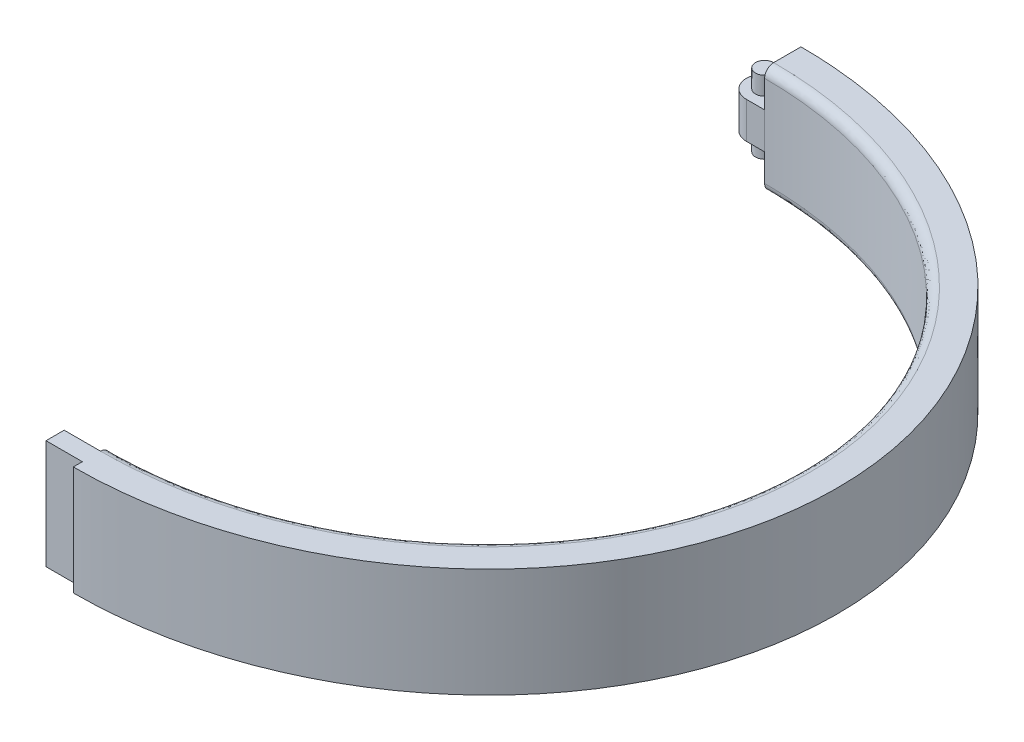
from build123d import *

# Parameters (mm, degrees)
BOSS_EXTRUDE1_DEPTH      = 30
SKETCH2_W                = 10
SKETCH2_H                = 10
BOSS_EXTRUDE2_DEPTH      = 10
BOSS_EXTRUDE3_DEPTH      = 5
BOSS_EXTRUDE3_DEPTH_BACK = 15
SKETCH3_R                = 2.5
SKETCH4_W                = 5
SKETCH4_H                = 30
BOSS_EXTRUDE4_DEPTH      = 10
FILLET2_R                = 5
FILLET1_R                = 2.5


with BuildPart() as part:
    # Sketch1 → Boss-Extrude1 (new body)
    with BuildSketch(Plane(origin=(0, 0, 0), x_dir=(1, 0, 0), z_dir=(0, 1, 0))):
        with BuildLine():
            Line((0, 100), (0, 90))
            add(Edge.make_bspline(
                [(0, -90), (100, -90), (100, 0), (100, 90), (0, 90)],
                knots=[1.570796327, 1.570796327, 1.570796327, 3.141592654, 3.141592654, 4.71238898, 4.71238898, 4.71238898], degree=2, weights=[1, 0.707106781, 1, 0.707106781, 1]))
            Line((0, -90), (0, -100))
            add(Edge.make_bspline(
                [(0, -100), (110, -100), (110, 0), (110, 100), (0, 100)],
                knots=[4.71238898, 4.71238898, 4.71238898, 6.283185307, 6.283185307, 7.853981634, 7.853981634, 7.853981634], degree=2, weights=[1, 0.707106781, 1, 0.707106781, 1]))
        make_face()
    extrude(amount=BOSS_EXTRUDE1_DEPTH)

    # Sketch2 → Boss-Extrude2 (add)
    with BuildSketch(Plane.ZY):
        with Locations((-95, 15)):
            Rectangle(SKETCH2_W, SKETCH2_H)
    extrude(amount=BOSS_EXTRUDE2_DEPTH)

    # Sketch3 → Boss-Extrude3 (add, two sides: drawn at the far end of the back side and taken through both)
    with BuildSketch(Plane.XZ.offset(-10).offset(-BOSS_EXTRUDE3_DEPTH_BACK)):
        with Locations(Location((-5, -95, 0), (0, 0, 270))):
            Circle(SKETCH3_R)
    extrude(amount=BOSS_EXTRUDE3_DEPTH + BOSS_EXTRUDE3_DEPTH_BACK)

    # Sketch4 → Boss-Extrude4 (add)
    with BuildSketch(Plane.ZY):
        with Locations((95, 15)):
            Rectangle(SKETCH4_W, SKETCH4_H)
    extrude(amount=BOSS_EXTRUDE4_DEPTH)

    # Fillet2
    fillet2_edges = [part.edges().sort_by_distance(p)[0] for p in [
        (-10, 15, -100),
        (-10, 15, -90),
    ]]
    fillet(fillet2_edges, radius=FILLET2_R - 0.0001)  # a hair under: the kernel refuses the full size

    # Fillet1
    fillet1_edges = [part.edges().sort_by_distance(p)[0] for p in [
        (100, 30, 0),
        (100, 0, 0),
    ]]
    fillet(fillet1_edges, radius=FILLET1_R)


solid = part.part
